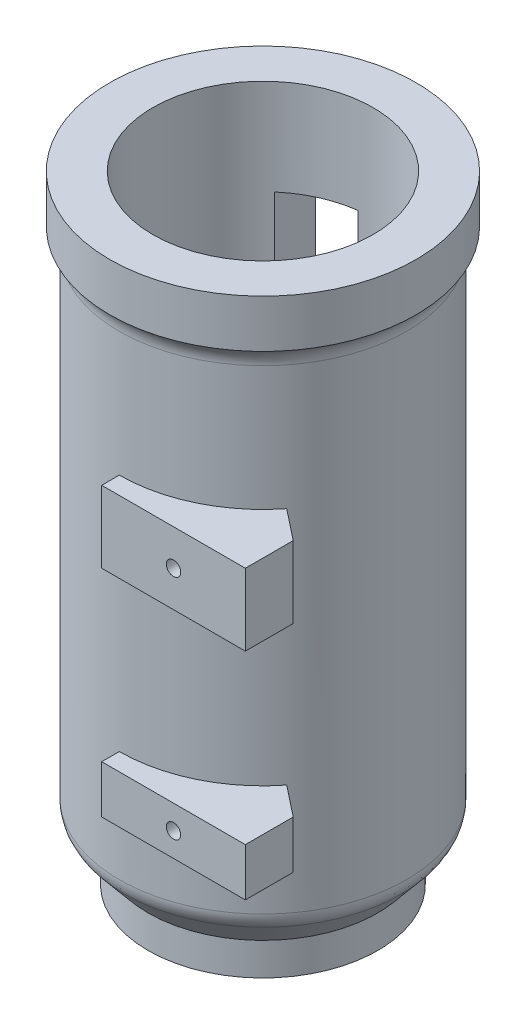
from build123d import *

# Parameters (mm, degrees)
CROQUIS1_R                   = 22.5
CROQUIS2_R                   = 30
CROQUIS3_R                   = 30
SALIENTE_EXTRUIR1_DEPTH      = 105
CROQUIS4_R                   = 32
SALIENTE_EXTRUIR2_DEPTH      = 10
CROQUIS6_R                   = 23
CORTAR_EXTRUIR1_DEPTH        = 161
SALIENTE_EXTRUIR3_DEPTH      = 3
SALIENTE_EXTRUIR3_DEPTH_BACK = 5
CROQUIS7_R                   = 24
CROQUIS7_R_2                 = 23
REDONDEO1_R                  = 5
CROQUIS9_W                   = 12
CROQUIS9_H                   = 40
CORTAR_EXTRUIR2_DEPTH        = 525
SALIENTE_EXTRUIR4_START      = -15
SALIENTE_EXTRUIR4_DEPTH      = 15
SALIENTE_EXTRUIR5_DEPTH      = 10
CROQUIS12_R                  = 1.5
CORTAR_EXTRUIR3_DEPTH        = 13


with BuildPart() as part:
    # Croquis1 → Recubrir1 section 0
    with BuildSketch(Plane(origin=(0, 0, 0), x_dir=(1, 0, 0), z_dir=(0, 1, 0))):
        Circle(CROQUIS1_R)
    # Croquis2 → Recubrir1 section 1
    with BuildSketch(Plane(origin=(0, 9, 0), x_dir=(1, 0, 0), z_dir=(0, 1, 0))):
        Circle(CROQUIS2_R)
    loft()

    # Croquis3 → Saliente-Extruir1 (add)
    with BuildSketch(Plane(origin=(0, 9, 0), x_dir=(1, 0, 0), z_dir=(0, 1, 0))):
        with Locations(Location((0, 0, 0), (0, 0, 270))):
            Circle(CROQUIS3_R)
    extrude(amount=SALIENTE_EXTRUIR1_DEPTH)

    # Croquis4 → Saliente-Extruir2 (add)
    with BuildSketch(Plane(origin=(0, 114, 0), x_dir=(1, 0, 0), z_dir=(0, 1, 0))):
        with Locations(Location((0, 0, 0), (0, 0, 270))):
            Circle(CROQUIS4_R)
    extrude(amount=SALIENTE_EXTRUIR2_DEPTH)

    # Croquis6 → Cortar-Extruir1 (cut)
    with BuildSketch(Plane(origin=(0, 124, 0), x_dir=(1, 0, 0), z_dir=(0, 1, 0))):
        with Locations(Location((0, 0, 0), (0, 0, 270))):
            Circle(CROQUIS6_R)
    extrude(amount=-CORTAR_EXTRUIR1_DEPTH, mode=Mode.SUBTRACT)

    # Croquis7 → Saliente-Extruir3 (add, two sides: drawn at the far end of the back side and taken through both)
    with BuildSketch(Plane(origin=(0, 0, 0), x_dir=(1, 0, 0), z_dir=(0, 1, 0)).offset(-SALIENTE_EXTRUIR3_DEPTH_BACK)):
        with Locations(Location((0, 0, 0), (0, 0, 270))):
            Circle(CROQUIS7_R)
        with Locations(Location((0, 0, 0), (0, 0, 270))):
            Circle(CROQUIS7_R_2, mode=Mode.SUBTRACT)
    extrude(amount=SALIENTE_EXTRUIR3_DEPTH + SALIENTE_EXTRUIR3_DEPTH_BACK)

    # Redondeo1
    # the kernel refuses this fillet: 5 mm, written as the material it adds along each edge
    with BuildSketch(Plane(origin=(0, 114, 0), x_dir=(0, 0, 1), z_dir=(-1, 0, 0))) as redondeo1_piece_1:
        with BuildLine():
            CenterArc((35, -4), REDONDEO1_R, 126.869897646, 53.130102354)
            Line((32, 0), (30, 0))
            Line((30, 0), (30, -4))
        make_face()
    redondeo1_piece_1_solid = revolve(axis=Axis((0, 114, 0), (0, 1, 0)), mode=Mode.PRIVATE)
    add([redondeo1_piece_1_solid])
    # the kernel refuses this fillet: 5 mm, written as the material it takes off along each edge
    with BuildSketch(Plane(origin=(0, 9, 0), x_dir=(1, 0, 0), z_dir=(0, 0, 1))) as redondeo1_2_piece_1:
        with BuildLine():
            CenterArc((30 - REDONDEO1_R, REDONDEO1_R * 0.362049935181), REDONDEO1_R, 320.194428908, 39.805571092)
            Line((30, REDONDEO1_R * 0.362049935181), (30, 0))
            Line((30, 0), (30 - REDONDEO1_R * 0.231778720403, -REDONDEO1_R * 0.278134464483))
        make_face()
    redondeo1_2_piece_1_solid = revolve(axis=Axis((0, 9, 0), (0, 1, 0)), revolution_arc=270, mode=Mode.PRIVATE)
    with BuildSketch(Plane(origin=(0, 9, 0), x_dir=(0, 0, 1), z_dir=(-1, 0, 0))) as redondeo1_2_piece_2:
        with BuildLine():
            CenterArc((30 - REDONDEO1_R, REDONDEO1_R * 0.362049935181), REDONDEO1_R, 320.194428908, 39.805571092)
            Line((30, REDONDEO1_R * 0.362049935181), (30, 0))
            Line((30, 0), (30 - REDONDEO1_R * 0.231778720403, -REDONDEO1_R * 0.278134464483))
        make_face()
    redondeo1_2_piece_2_solid = revolve(axis=Axis((0, 9, 0), (0, 1, 0)), revolution_arc=90, mode=Mode.PRIVATE)
    add([redondeo1_2_piece_1_solid, redondeo1_2_piece_2_solid], mode=Mode.SUBTRACT)

    # Croquis9 → Cortar-Extruir2 (cut)
    with BuildSketch(Plane.XY):
        with Locations((-9, 84)):
            Rectangle(CROQUIS9_W, CROQUIS9_H)
    extrude(amount=-CORTAR_EXTRUIR2_DEPTH, mode=Mode.SUBTRACT)

    # Croquis10 → Saliente-Extruir4 (add)
    with BuildSketch(Plane(origin=(0, 84, 0), x_dir=(1, 0, 0), z_dir=(0, 1, 0)).offset(SALIENTE_EXTRUIR4_START)):
        with BuildLine():
            Line((0, -30), (0, -33.675648379))
            Line((0, -33.675648379), (30, -33.675648379))
            Line((30, -33.675648379), (30, -23.675648379))
            Line((30, -23.675648379), (23.549751452, -18.585187827))
            ThreePointArc((23.549751452, -18.585187827), (13.085189437, -26.995885194), (0, -30))
        make_face()
    extrude(amount=SALIENTE_EXTRUIR4_DEPTH)

    # Croquis11 → Saliente-Extruir5 (add)
    with BuildSketch(Plane(origin=(0, 24, 0), x_dir=(1, 0, 0), z_dir=(0, 1, 0))):
        with BuildLine():
            Line((30, -23.675648379), (23.549751452, -18.585187827))
            ThreePointArc((23.549751452, -18.585187827), (13.085189437, -26.995885194), (0, -30))
            Line((0, -30), (0, -33.675648379))
            Line((0, -33.675648379), (30, -33.675648379))
            Line((30, -33.675648379), (30, -23.675648379))
        make_face()
    extrude(amount=SALIENTE_EXTRUIR5_DEPTH)

    # Croquis12 → Cortar-Extruir3 (cut)
    with BuildSketch(Plane.XY.offset(33.675648379)):
        with Locations((15, 29)):
            Circle(CROQUIS12_R)
        with Locations((15, 76.5)):
            Circle(CROQUIS12_R)
    extrude(amount=-CORTAR_EXTRUIR3_DEPTH, mode=Mode.SUBTRACT)


solid = part.part
